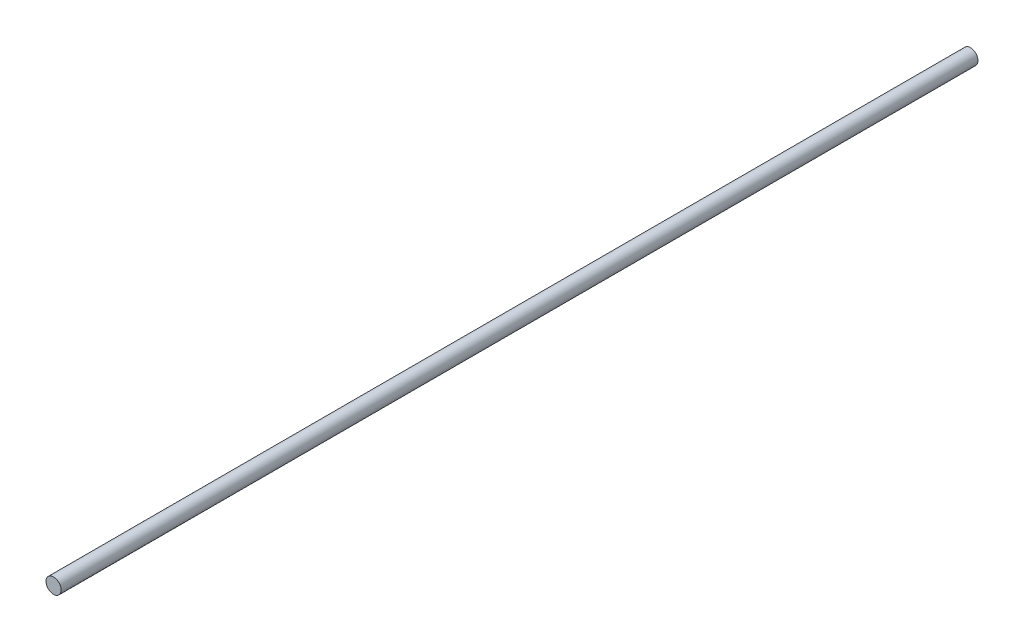
from build123d import *

# Parameters (mm, degrees)
CROQUIS1_R              = 5
SALIENTE_EXTRUIR1_DEPTH = 605.8


with BuildPart() as part:
    # Croquis1 → Saliente-Extruir1 (new body)
    with BuildSketch(Plane.XY):
        Circle(CROQUIS1_R)
    extrude(amount=SALIENTE_EXTRUIR1_DEPTH)


solid = part.part
